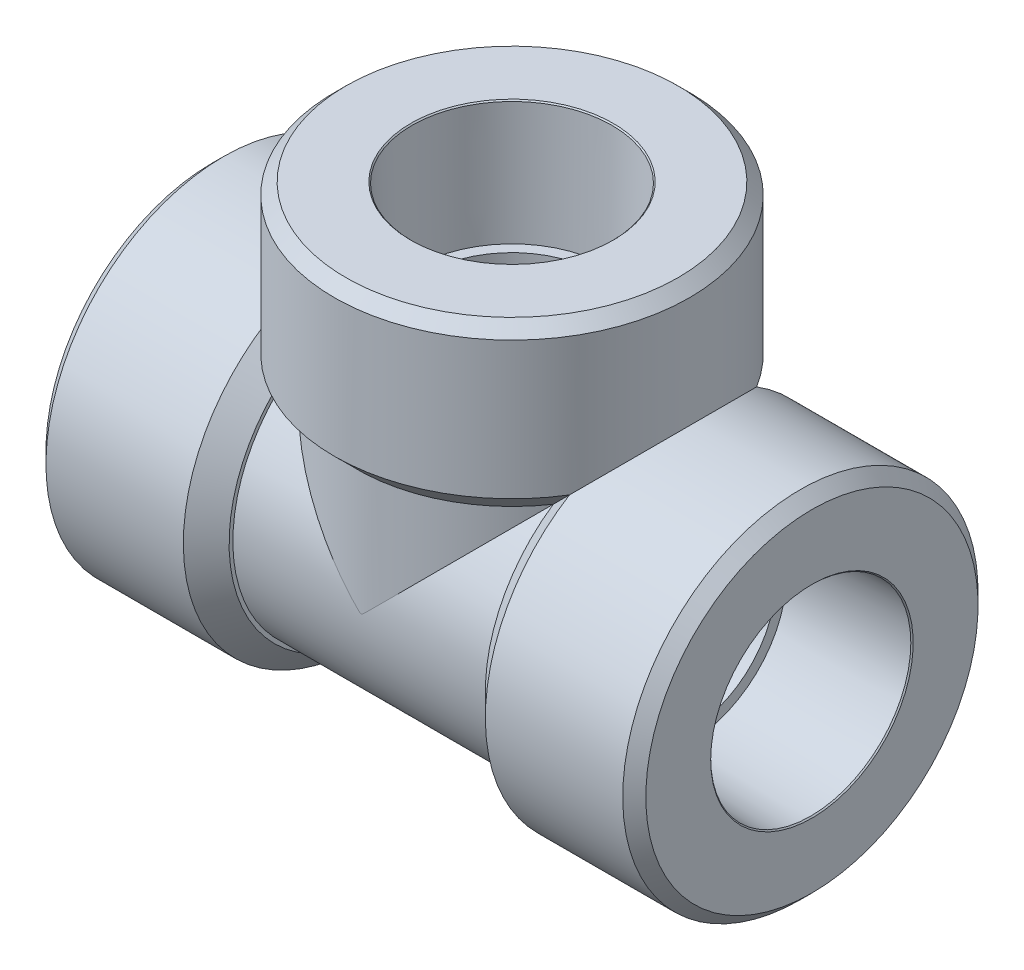
from build123d import *

# Parameters (mm, degrees)
LOFT1_START                 = -33.02
LOFT1_DEPTH                 = 66.04
SKETCH19_R                  = 16.6243
EXTRUDE1_DEPTH              = 33.02
CIRPATTERN1_COUNT           = 3
CIRPATTERN1_ANGLE           = 180
SKETCH10_R                  = 10.668
CUT_EXTRUDE1_DEPTH          = 66.094407194
CUT_EXTRUDE1_DRAFT          = 1.5
SKETCH16_R                  = 9.489586861
CUT_EXTRUDE4_DEPTH          = 19.558
CIRPATTERN2_COUNT           = 3
CIRPATTERN2_ANGLE           = 180
CIRPATTERN2_COPY_1_SKETCH_R = 10.668
CIRPATTERN2_COPY_1_DEPTH    = 66.094407194
CIRPATTERN2_COPY_1_DRAFT    = 1.5
CIRPATTERN2_COPY_2_SKETCH_R = 10.668
CIRPATTERN2_COPY_2_DEPTH    = 66.094407194
CIRPATTERN2_COPY_2_DRAFT    = 1.5


# Read off the part's stored shape, not the designer's step: Loft1
with BuildPart() as part:
    # Loft1 outline → Loft1 (new body)
    with BuildSketch(Plane.YZ.offset(LOFT1_START)):
        with BuildLine():
            add(Edge.make_bspline(
                [(-16.6243, 0), (-16.6243, 2.176115764), (-15.759592321, 6.527509392), (-12.061446851, 12.061698105), (-6.527773493, 15.759171216), (0, 17.05774219), (6.527773493, 15.759171216), (12.061446851, 12.061698105), (15.759592321, 6.527509392), (16.6243, 2.176115764), (16.6243, -2.176115764), (15.759592321, -6.527509392), (12.061446851, -12.061698105), (6.527773493, -15.759171216), (0, -17.05774219), (-6.527773493, -15.759171216), (-12.061446851, -12.061698105), (-15.759592321, -6.527509392), (-16.6243, -2.176115764), (-16.6243, 0)],
                knots=[0, 0, 0, 0, 0.0625, 0.125, 0.1875, 0.25, 0.3125, 0.375, 0.4375, 0.5, 0.5, 0.5625, 0.625, 0.6875, 0.75, 0.8125, 0.875, 0.9375, 1, 1, 1, 1], degree=3))
        make_face()
    extrude(amount=LOFT1_DEPTH)

    # Sketch19 → Extrude1 (add)
    with BuildSketch(Plane(origin=(0, 0, 0), x_dir=(1, 0, 0), z_dir=(0, 1, 0))):
        with Locations(Location((0, 0, 0), (0, 0, 90))):
            Circle(SKETCH19_R)
    extrude(amount=EXTRUDE1_DEPTH)

    # Sketch8 → Revolve1 (revolve)
    with BuildSketch(Plane.XY):
        Polygon((-33.02, 0), (-14.1062075, 0), (-14.1062075, 17.0399075), (-16.6243, 19.558), (-31.74873, 19.558), (-33.02, 18.28673), align=None)
    revolve1 = revolve(axis=Axis((0, 0, 0), (-1, 0, 0)))

    # CirPattern1: Revolve1 ×3 about axis
    cirpattern1_axis = Axis((0, 0, 0), (0, 0, -1))
    for i in range(1, CIRPATTERN1_COUNT):
        add(revolve1.rotate(cirpattern1_axis, i * CIRPATTERN1_ANGLE / (CIRPATTERN1_COUNT - 1)))


with BuildPart() as cut_extrude1_tool:
    # Sketch10 → Cut-Extrude1 (with draft: the straight prism first)
    with BuildSketch(Plane(origin=(-19.558, 0, 0), x_dir=(0, 0, -1), z_dir=(1, 0, 0))):
        Circle(SKETCH10_R)
    extrude(amount=-CUT_EXTRUDE1_DEPTH)
    # Cut-Extrude1: the draft: its side faces are tilted about the plane it starts from
    cut_extrude1_sides = [cut_extrude1_tool.faces().sort_by_distance(p)[0] for p in [
        (-52.605203597, 0, 10.668),
    ]]
    draft(cut_extrude1_sides, Plane(origin=(-19.558, 0, 0), x_dir=(0, 0, -1), z_dir=(1, 0, 0)), CUT_EXTRUDE1_DRAFT)


with BuildPart() as part_1:
    add(part.part)

    # Cut-Extrude1: cut by cut_extrude1_tool
    add(cut_extrude1_tool.part, mode=Mode.SUBTRACT)

    # Cut-Extrude3 cone 1 section (through the dimple's axis) → Cut-Extrude3 (revolve, cut)
    with BuildSketch(Plane(origin=(-33.02, 0, 0), x_dir=(0, 0, 1), z_dir=(0, 1, 0))):
        Polygon((0, 0), (11.147514876, 0), (0, 11.147514876), align=None)
    cut_extrude3 = revolve(axis=Axis((-33.02, 0, 0), (1, 0, 0)), mode=Mode.SUBTRACT)

    # Sketch16 → Cut-Extrude4 (cut)
    with BuildSketch(Plane(origin=(-19.558, 0, 0), x_dir=(0, 0, -1), z_dir=(1, 0, 0))):
        Circle(SKETCH16_R)
    cut_extrude4 = extrude(amount=CUT_EXTRUDE4_DEPTH, mode=Mode.SUBTRACT)

    # CirPattern2: Cut-Extrude3, Cut-Extrude4 ×3 about axis
    cirpattern2_axis = Axis((0, 0, 0), (0, 0, -1))
    add([cut_extrude3.rotate(cirpattern2_axis, i * CIRPATTERN2_ANGLE / (CIRPATTERN2_COUNT - 1)) for i in range(1, CIRPATTERN2_COUNT)], mode=Mode.SUBTRACT)
    add([cut_extrude4.rotate(cirpattern2_axis, i * CIRPATTERN2_ANGLE / (CIRPATTERN2_COUNT - 1)) for i in range(1, CIRPATTERN2_COUNT)], mode=Mode.SUBTRACT)


with BuildPart() as cirpattern2_copy_1_tool:
    # CirPattern2 copy 1 sketch → CirPattern2 copy 1 (with draft: the straight prism first)
    with BuildSketch(Plane(origin=(0, 19.558, 0), x_dir=(0, 0, -1), z_dir=(0, -1, 0))):
        Circle(CIRPATTERN2_COPY_1_SKETCH_R)
    extrude(amount=-CIRPATTERN2_COPY_1_DEPTH)
    # CirPattern2 copy 1: the draft: its side faces are tilted about the plane it starts from
    cirpattern2_copy_1_sides = [cirpattern2_copy_1_tool.faces().sort_by_distance(p)[0] for p in [
        (0, 52.605203597, 10.668),
    ]]
    draft(cirpattern2_copy_1_sides, Plane(origin=(0, 19.558, 0), x_dir=(0, 0, -1), z_dir=(0, -1, 0)), CIRPATTERN2_COPY_1_DRAFT)


with BuildPart() as part_2:
    add(part_1.part)

    # CirPattern2 copy 1: cut by cirpattern2_copy_1_tool
    add(cirpattern2_copy_1_tool.part, mode=Mode.SUBTRACT)


with BuildPart() as cirpattern2_copy_2_tool:
    # CirPattern2 copy 2 sketch → CirPattern2 copy 2 (with draft: the straight prism first)
    with BuildSketch(Plane(origin=(19.558, 0, 0), x_dir=(0, 0, -1), z_dir=(-1, 0, 0))):
        Circle(CIRPATTERN2_COPY_2_SKETCH_R)
    extrude(amount=-CIRPATTERN2_COPY_2_DEPTH)
    # CirPattern2 copy 2: the draft: its side faces are tilted about the plane it starts from
    cirpattern2_copy_2_sides = [cirpattern2_copy_2_tool.faces().sort_by_distance(p)[0] for p in [
        (52.605203597, 0, 10.668),
    ]]
    draft(cirpattern2_copy_2_sides, Plane(origin=(19.558, 0, 0), x_dir=(0, 0, -1), z_dir=(-1, 0, 0)), CIRPATTERN2_COPY_2_DRAFT)


with BuildPart() as part_3:
    add(part_2.part)

    # CirPattern2 copy 2: cut by cirpattern2_copy_2_tool
    add(cirpattern2_copy_2_tool.part, mode=Mode.SUBTRACT)


solid = part_3.part
